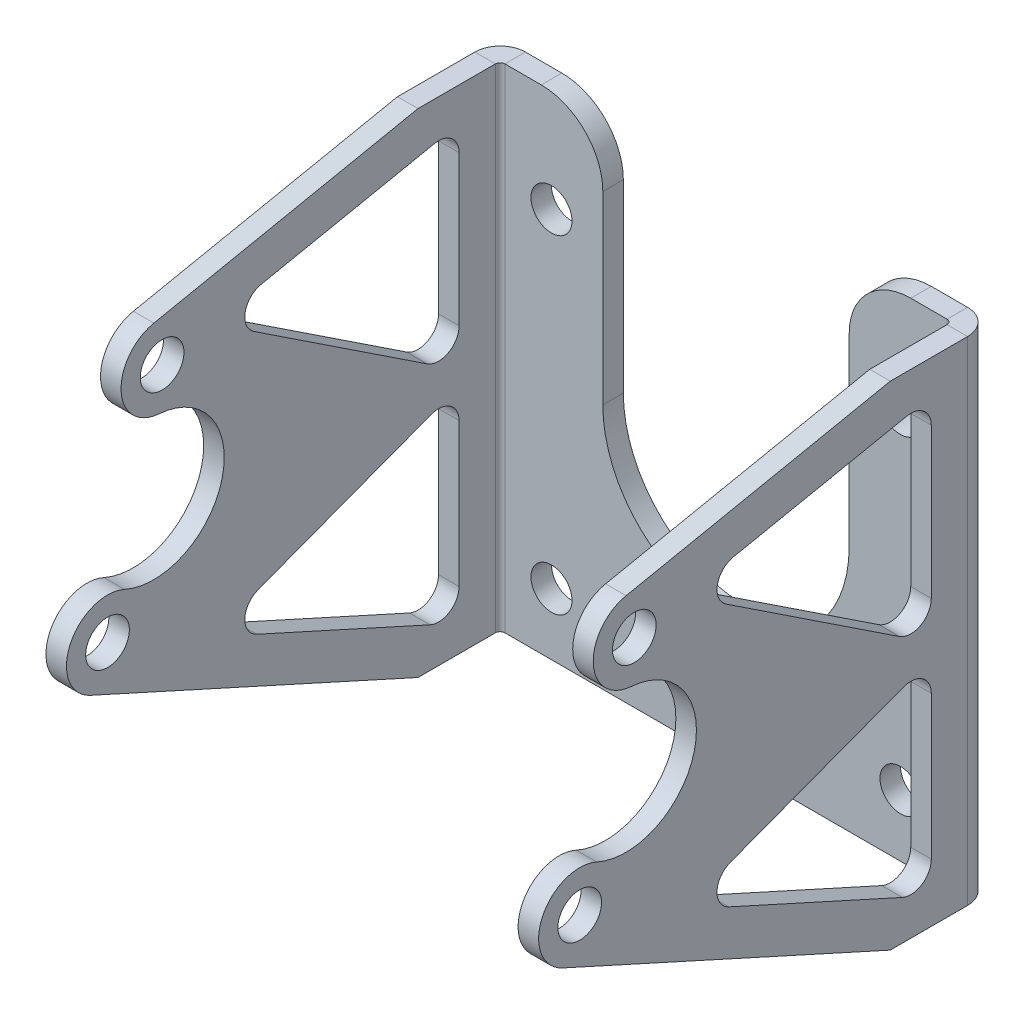
from build123d import *

# Parameters (mm, degrees)
SKETCH4_R                      = 3.175
BASE_FLANGE1_DEPTH             = 3.175
EDGE_FLANGE1_STRIP_W           = 14.1732
EDGE_FLANGE1_STRIP_H           = 3.175
EDGE_FLANGE1_STRIP_CUT_DEPTH   = 76.2
EDGE_FLANGE1_STRIP_2_W         = 14.1732
EDGE_FLANGE1_STRIP_2_H         = 3.175
EDGE_FLANGE1_STRIP_CUT_2_DEPTH = 76.2
EDGE_FLANGE1_DEPTH             = 76.2
EDGE_FLANGE1_BEND_DEPTH        = 76.2
CUT_EXTRUDE2_DEPTH             = 113.499830191
CUT_EXTRUDE3_REACH             = 110.728
SKETCH21_R                     = 3.3782


# Sheet-metal steps are written as plain solids
with BuildPart() as part:
    # Sketch4 → Base-Flange1 (new body)
    with BuildSketch(Plane.XY):
        with BuildLine():
            Line((38.470301513, 37.249760359), (28.945301513, 37.249760359))
            ThreePointArc((28.945301513, 37.249760359), (22.210109423, 34.45995245), (19.420301513, 27.724760359))
            Line((19.420301513, 27.724760359), (19.420301513, -0.850239641))
            ThreePointArc((19.420301513, -0.850239641), (0.370301513, -19.900239641), (-18.679698487, -0.850239641))
            Line((-18.679698487, -0.850239641), (-18.679698487, 27.724760359))
            ThreePointArc((-18.679698487, 27.724760359), (-21.469506396, 34.45995245), (-28.204698487, 37.249760359))
            Line((-28.204698487, 37.249760359), (-37.729698487, 37.249760359))
            Line((-37.729698487, 37.249760359), (-37.729698487, -38.950239641))
            Line((-37.729698487, -38.950239641), (38.470301513, -38.950239641))
            Line((38.470301513, -38.950239641), (38.470301513, 37.249760359))
        make_face()
        with Locations((-26.617198487, -29.425239641)):
            Circle(SKETCH4_R, mode=Mode.SUBTRACT)
        with Locations((27.357801513, -29.425239641)):
            Circle(SKETCH4_R, mode=Mode.SUBTRACT)
        with Locations((27.357801513, 21.374760359)):
            Circle(SKETCH4_R, mode=Mode.SUBTRACT)
        with Locations((-26.617198487, 21.374760359)):
            Circle(SKETCH4_R, mode=Mode.SUBTRACT)
    extrude(amount=-BASE_FLANGE1_DEPTH)

    # Edge-Flange1 strip (across the edge) → Edge-Flange1 strip cut (cut)
    with BuildSketch(Plane(origin=(38.470301513, -38.950239641, 0), x_dir=(-1, 0, 0), z_dir=(0, 1, 0))):
        with Locations((-3.175, -1.5875)):
            Rectangle(EDGE_FLANGE1_STRIP_W, EDGE_FLANGE1_STRIP_H)
    extrude(amount=EDGE_FLANGE1_STRIP_CUT_DEPTH, mode=Mode.SUBTRACT)

    # Edge-Flange1 strip 2 (across the edge) → Edge-Flange1 strip cut 2 (cut)
    with BuildSketch(Plane(origin=(-37.729698487, 37.249760359, 0), x_dir=(1, 0, 0), z_dir=(0, -1, 0))):
        with Locations((-3.175, -1.5875)):
            Rectangle(EDGE_FLANGE1_STRIP_2_W, EDGE_FLANGE1_STRIP_2_H)
    extrude(amount=EDGE_FLANGE1_STRIP_CUT_2_DEPTH, mode=Mode.SUBTRACT)

    # Edge-Flange1 section (across the edge) → Edge-Flange1 (add)
    with BuildSketch(Plane(origin=(38.470301513, -38.950239641, 0), x_dir=(-1, 0, 0), z_dir=(0, 1, 0))):
        with BuildLine():
            Line((0, 0.7366), (0, 73.025))
            Line((0, 73.025), (3.175, 73.025))
            Line((3.175, 73.025), (3.175, 0.7366))
            ThreePointArc((3.175, 0.7366), (3.390745145, 0.215745145), (3.9116, 0))
            Line((3.9116, 0), (3.9116, -3.175))
            ThreePointArc((3.9116, -3.175), (1.145681115, -2.029318885), (0, 0.7366))
        make_face()
    extrude(amount=EDGE_FLANGE1_DEPTH)

    # Edge-Flange1 section 2 (across the edge) → Edge-Flange1 bend (add)
    with BuildSketch(Plane(origin=(-37.729698487, 37.249760359, 0), x_dir=(1, 0, 0), z_dir=(0, -1, 0))):
        with BuildLine():
            Line((0, 0.7366), (0, 73.025))
            Line((0, 73.025), (3.175, 73.025))
            Line((3.175, 73.025), (3.175, 0.7366))
            ThreePointArc((3.175, 0.7366), (3.390745145, 0.215745145), (3.9116, 0))
            Line((3.9116, 0), (3.9116, -3.175))
            ThreePointArc((3.9116, -3.175), (1.145681115, -2.029318885), (0, 0.7366))
        make_face()
    extrude(amount=EDGE_FLANGE1_BEND_DEPTH)

    # Sketch18 → Cut-Extrude2 (cut, through all)
    with BuildSketch(Plane(origin=(38.470301513, 0, 0), x_dir=(0, 0, -1), z_dir=(1, 0, 0))):
        with BuildLine():
            Line((-12.7, 37.249760359), (-53.545242344, 28.944361059))
            ThreePointArc((-53.545242344, 28.944361059), (-58.617648241, 22.326829154), (-52.763048756, 16.390104891))
            ThreePointArc((-52.763048756, 16.390104891), (-43.013397441, 2.790344649), (-58.09955595, -4.449613972))
            ThreePointArc((-58.09955595, -4.449613972), (-66.503585183, -7.614624659), (-63.338574497, -16.018653892))
            Line((-63.338574497, -16.018653892), (-12.7, -38.950239641))
            Line((-12.7, -38.950239641), (-73.025, -38.950239641))
            Line((-73.025, -38.950239641), (-73.025, 37.249760359))
            Line((-73.025, 37.249760359), (-12.7, 37.249760359))
        make_face()
    extrude(amount=-CUT_EXTRUDE2_DEPTH, mode=Mode.SUBTRACT)

    # Cut-Extrude3: up to this face of the body (flat: up to its plane)
    cut_extrude3_end = Plane(part.part.faces().sort_by_distance((-37.729698487, 0.375360162, 25.894827333))[0])
    # Sketch21 → Cut-Extrude3 (cut, up to the picked face)
    with BuildSketch(Plane(origin=(38.470301513, 0, 0), x_dir=(0, 0, -1), z_dir=(1, 0, 0)), mode=Mode.PRIVATE) as cut_extrude3_sk1:
        with Locations((-60.719065223, -10.234133932)):
            Circle(SKETCH21_R)
    cut_extrude3_tool1 = split(extrude(cut_extrude3_sk1.sketch, amount=-CUT_EXTRUDE3_REACH, mode=Mode.PRIVATE), bisect_by=cut_extrude3_end, keep=Keep.BOTH, mode=Mode.PRIVATE)
    # Sketch21 → Cut-Extrude3 (cut, up to the picked face)
    with BuildSketch(Plane(origin=(38.470301513, 0, 0), x_dir=(0, 0, -1), z_dir=(1, 0, 0)), mode=Mode.PRIVATE) as cut_extrude3_sk2:
        with Locations((-52.279937568, 22.721700549)):
            Circle(SKETCH21_R)
    cut_extrude3_tool2 = split(extrude(cut_extrude3_sk2.sketch, amount=-CUT_EXTRUDE3_REACH, mode=Mode.PRIVATE), bisect_by=cut_extrude3_end, keep=Keep.BOTH, mode=Mode.PRIVATE)
    # Sketch21 → Cut-Extrude3 (cut, up to the picked face)
    with BuildSketch(Plane(origin=(38.470301513, 0, 0), x_dir=(0, 0, -1), z_dir=(1, 0, 0)), mode=Mode.PRIVATE) as cut_extrude3_sk3:
        with BuildLine():
            Line((-10.64400026, -4.738220863), (-37.435582613, -14.828100623))
            ThreePointArc((-37.435582613, -14.828100623), (-39.489903551, -17.696138128), (-37.62633699, -20.691633633))
            Line((-37.62633699, -20.691633633), (-10.834754637, -32.824152651))
            ThreePointArc((-10.834754637, -32.824152651), (-7.804221974, -32.600140782), (-6.35, -29.931892671))
            Line((-6.35, -29.931892671), (-6.35, -7.709493893))
            ThreePointArc((-6.35, -7.709493893), (-7.718373423, -5.09860795), (-10.64400026, -4.738220863))
        make_face()
    cut_extrude3_tool3 = split(extrude(cut_extrude3_sk3.sketch, amount=-CUT_EXTRUDE3_REACH, mode=Mode.PRIVATE), bisect_by=cut_extrude3_end, keep=Keep.BOTH, mode=Mode.PRIVATE)
    # Sketch21 → Cut-Extrude3 (cut, up to the picked face)
    with BuildSketch(Plane(origin=(38.470301513, 0, 0), x_dir=(0, 0, -1), z_dir=(1, 0, 0)), mode=Mode.PRIVATE) as cut_extrude3_sk4:
        with BuildLine():
            Line((-38.069272281, 20.080292762), (-11.277689928, 2.343110591))
            ThreePointArc((-11.277689928, 2.343110591), (-8.022363238, 2.193595711), (-6.35, 4.990506107))
            Line((-6.35, 4.990506107), (-6.35, 28.175441224))
            ThreePointArc((-6.35, 28.175441224), (-7.516025925, 30.634027844), (-10.157652388, 31.286771479))
            Line((-10.157652388, 31.286771479), (-36.949234742, 25.839018533))
            ThreePointArc((-36.949234742, 25.839018533), (-39.433182282, 23.333848227), (-38.069272281, 20.080292762))
        make_face()
    cut_extrude3_tool4 = split(extrude(cut_extrude3_sk4.sketch, amount=-CUT_EXTRUDE3_REACH, mode=Mode.PRIVATE), bisect_by=cut_extrude3_end, keep=Keep.BOTH, mode=Mode.PRIVATE)
    add(cut_extrude3_tool1.solids().sort_by(Axis((38.470302, -10.234134, 60.719065), (-1, 0, 0)))[0], mode=Mode.SUBTRACT)
    add(cut_extrude3_tool2.solids().sort_by(Axis((38.470302, 22.721701, 52.279938), (-1, 0, 0)))[0], mode=Mode.SUBTRACT)
    add(cut_extrude3_tool3.solids().sort_by(Axis((38.470302, -18.49522, 18.845957), (-1, 0, 0)))[0], mode=Mode.SUBTRACT)
    add(cut_extrude3_tool4.solids().sort_by(Axis((38.470302, 18.532132, 18.821153), (-1, 0, 0)))[0], mode=Mode.SUBTRACT)


solid = part.part
